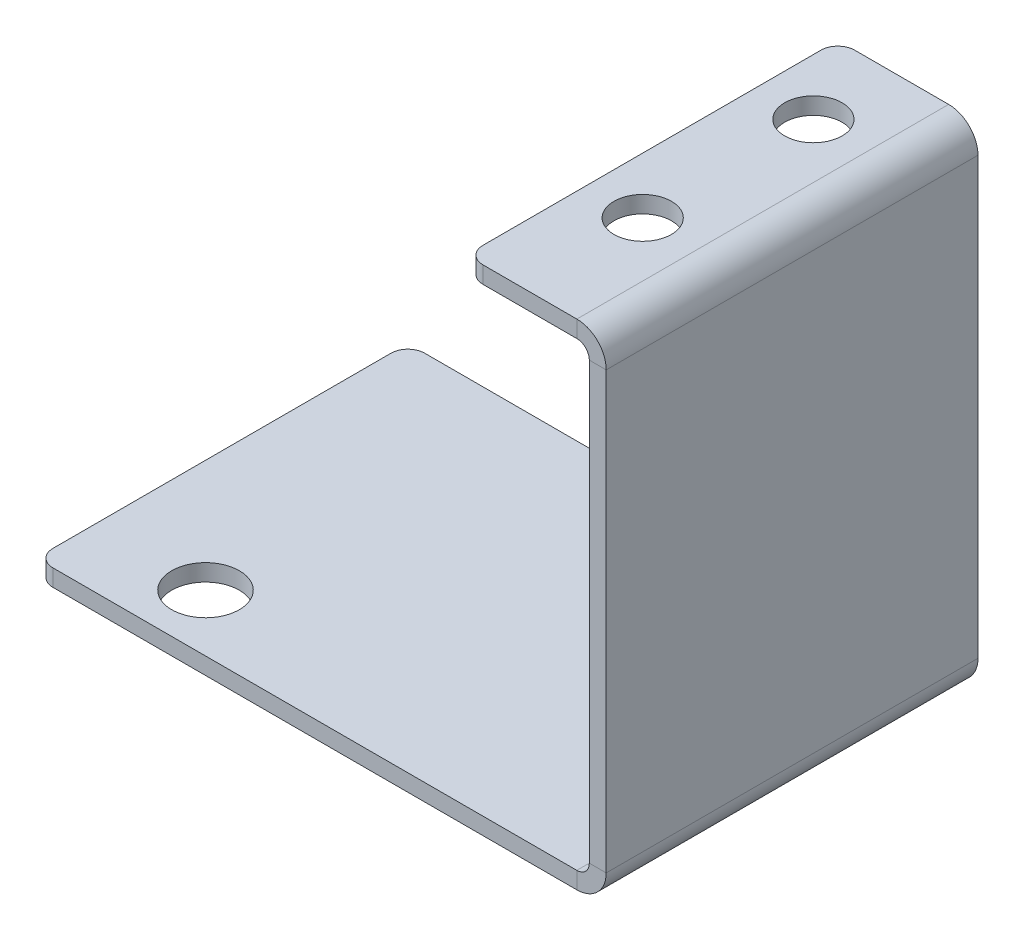
from build123d import *

# Parameters (mm, degrees)
SKETCH_1_W             = 68.22
SKETCH_1_H             = 22
SM_BASE_FLANGE_1_DEPTH = 1
FILLET_1_R             = 1
OTHER_START            = -15.667913645
OTHER_1_DEPTH          = 22
OTHER_1_2_DEPTH        = 22
OTHER_START_2          = 27.250753262
OTHER_1_3_DEPTH        = 1.749246738
SKETCH_7_R             = 2
CUT_EXTRUDE_1_DEPTH    = 40
SKETCH_7_6_R           = 1.7
CUT_EXTRUDE_4_DEPTH    = 20


with BuildPart() as part:
    # 基体-法兰1: sheet metal written as solids
    # Sketch 1 → 基体-法兰1 (new body)
    with BuildSketch(Plane(origin=(0, 0, 0), x_dir=(1, 0, 0), z_dir=(0, 1, 0))):
        with Locations((-53.201792275, 4.667913645)):
            Rectangle(SKETCH_1_W, SKETCH_1_H)
    extrude(amount=-SM_BASE_FLANGE_1_DEPTH)

    # 圆角1
    fillet_1_edges = [part.edges().sort_by_distance(p)[0] for p in [
        (-87.311792275, -0.5, -15.667913645),
        (-19.091792275, -0.5, -15.667913645),
        (-19.091792275, -0.5, 6.332086355),
        (-87.311792275, -0.5, 6.332086355),
    ]]
    fillet(fillet_1_edges, radius=FILLET_1_R)

    # Other 1: read off the stored shape, not the designer's step
    # Other 1 outline → Other 1 (cut)
    with BuildSketch(Plane.XY.offset(OTHER_START)):
        with BuildLine():
            Line((-19.091792275, 0), (-53.739151185, 0))
            ThreePointArc((-53.739151185, 0), (-54.379966111, -0.728828115), (-55.311792275, -1))
            Line((-55.311792275, -1), (-19.091792275, -1))
            Line((-19.091792275, -1), (-19.091792275, 0))
        make_face()
    extrude(amount=OTHER_1_DEPTH, mode=Mode.SUBTRACT)

    # Other 1 2 outline → Other 1 2 (add)
    with BuildSketch(Plane.XY.offset(OTHER_START)):
        with BuildLine():
            ThreePointArc((-53.739151185, 0), (-53.616677518, 0.359286442), (-53.575192275, 0.7366))
            Line((-53.575192275, 0.7366), (-53.575192275, 26.514153262))
            ThreePointArc((-53.575192275, 26.514153262), (-54.083830639, 27.742114898), (-55.311792275, 28.250753262))
            Line((-55.311792275, 28.250753262), (-61.869345538, 28.250753262))
            Line((-61.869345538, 28.250753262), (-61.869345538, 27.250753262))
            Line((-61.869345538, 27.250753262), (-55.311792275, 27.250753262))
            ThreePointArc((-55.311792275, 27.250753262), (-54.79093742, 27.035008117), (-54.575192275, 26.514153262))
            Line((-54.575192275, 26.514153262), (-54.575192275, 0.7366))
            ThreePointArc((-54.575192275, 0.7366), (-54.79093742, 0.215745145), (-55.311792275, 0))
            Line((-55.311792275, 0), (-53.739151185, 0))
        make_face()
    extrude(amount=OTHER_1_2_DEPTH)

    # Other 1 3 outline → Other 1 3 (cut)
    with BuildSketch(Plane(origin=(0, 0, 0), x_dir=(1, 0, 0), z_dir=(0, 1, 0)).offset(OTHER_START_2)):
        with BuildLine():
            Line((-61.869345538, -6.332086355), (-60.869345538, -6.332086355))
            ThreePointArc((-60.869345538, -6.332086355), (-61.576452319, -6.039193136), (-61.869345538, -5.332086355))
            Line((-61.869345538, -5.332086355), (-61.869345538, -6.332086355))
        make_face()
        with BuildLine():
            Line((-61.869345538, 15.667913645), (-61.869345538, 14.667913645))
            ThreePointArc((-61.869345538, 14.667913645), (-61.576452319, 15.375020426), (-60.869345538, 15.667913645))
            Line((-60.869345538, 15.667913645), (-61.869345538, 15.667913645))
        make_face()
    extrude(amount=OTHER_1_3_DEPTH, mode=Mode.SUBTRACT)

    # 草图7 → 切除-拉伸1 (cut)
    with BuildSketch(Plane(origin=(0, 28.250753262, 0), x_dir=(1, 0, 0), z_dir=(0, 1, 0))):
        with Locations(Location((-80.654608631, -2.961737693, 0), (0, 0, 90))):
            Circle(SKETCH_7_R)
    extrude(amount=-CUT_EXTRUDE_1_DEPTH, mode=Mode.SUBTRACT)

    # 草图7<6> → 切除-拉伸4 (cut)
    with BuildSketch(Plane(origin=(0, 28.250753262, 0), x_dir=(1, 0, 0), z_dir=(0, 1, 0))):
        with Locations(Location((-58.548227621, 10.901663137, 0), (0, 0, 180))):
            Circle(SKETCH_7_6_R)
        with Locations(Location((-58.548227621, 0.801663137, 0), (0, 0, 180))):
            Circle(SKETCH_7_6_R)
    extrude(amount=-CUT_EXTRUDE_4_DEPTH, mode=Mode.SUBTRACT)


solid = part.part
